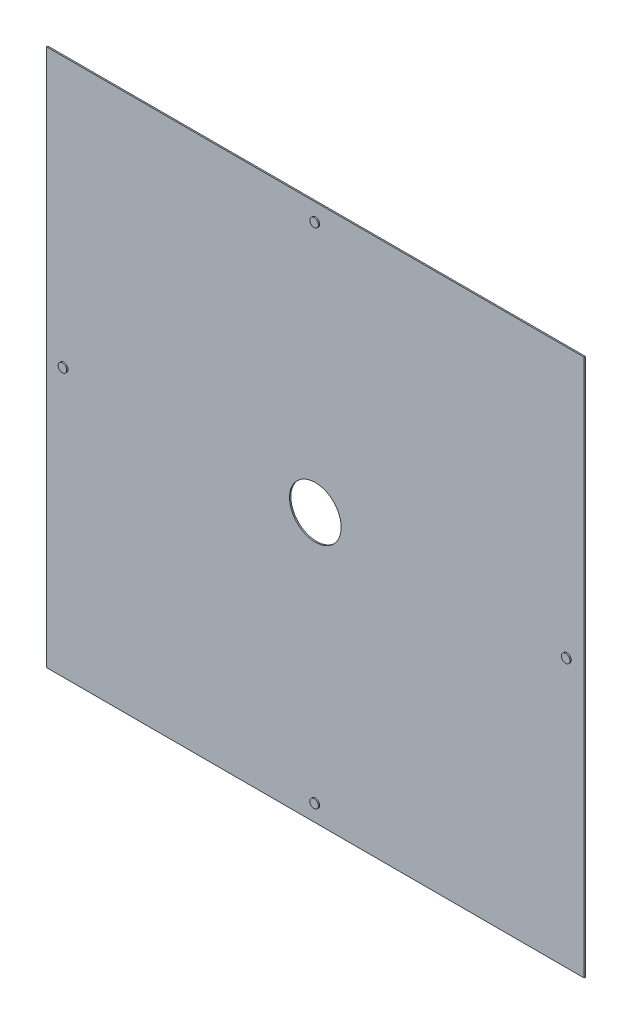
from build123d import *

# Parameters (mm, degrees)
SKETCH2_W           = 625
SKETCH2_H           = 625
SKETCH2_R           = 30
BOSS_EXTRUDE1_DEPTH = 1.5
SKETCH3_R           = 5
BOSS_EXTRUDE2_DEPTH = 1.5


with BuildPart() as part:
    # Sketch2 → Boss-Extrude1 (new body)
    with BuildSketch(Plane.XY):
        Rectangle(SKETCH2_W, SKETCH2_H)
        Circle(SKETCH2_R, mode=Mode.SUBTRACT)
    extrude(amount=BOSS_EXTRUDE1_DEPTH)

    # Sketch3 → Boss-Extrude2 (add)
    with BuildSketch(Plane.XY.offset(1.5)):
        with Locations((0, 292.5)):
            Circle(SKETCH3_R)
        with Locations((-292.5, 0)):
            Circle(SKETCH3_R)
        with Locations((0, -292.5)):
            Circle(SKETCH3_R)
        with Locations((292.5, 0)):
            Circle(SKETCH3_R)
    extrude(amount=BOSS_EXTRUDE2_DEPTH)


solid = part.part
